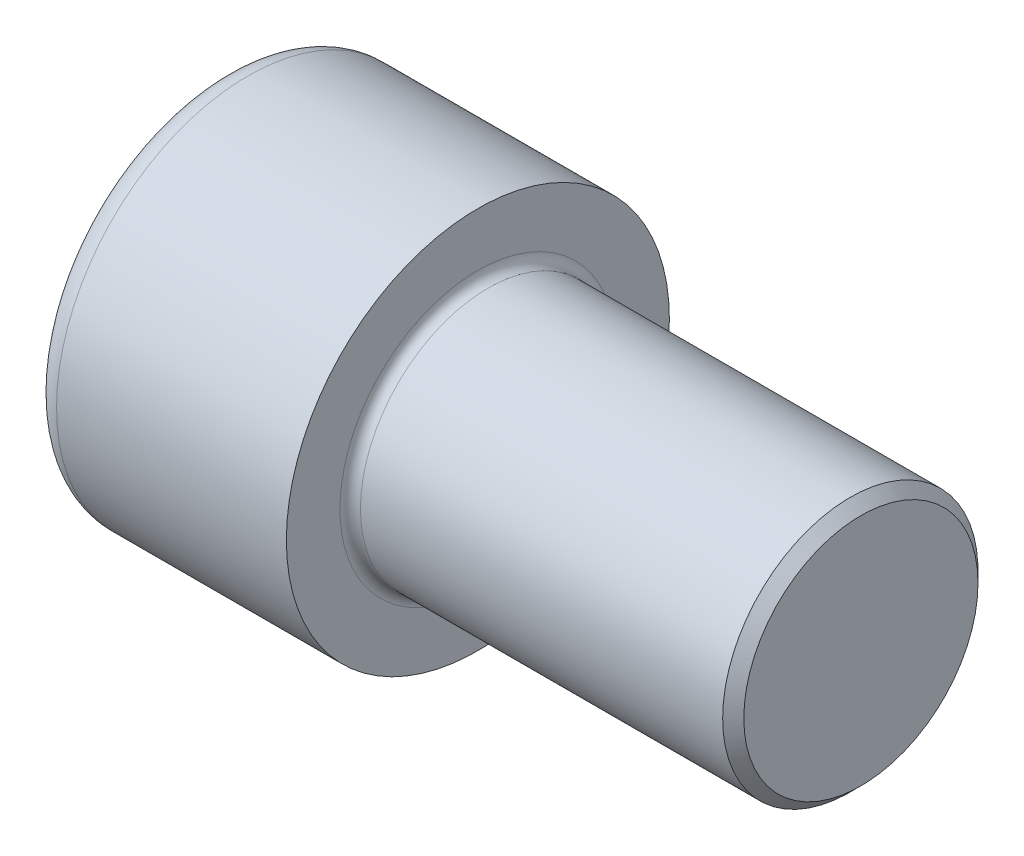
from build123d import *

# Parameters (mm, degrees)
FILLET1_R   = 0.8
FILLET2_R   = 2
HEX_2_DEPTH = 10


with BuildPart() as part:
    # BodySke → Base-Revolve (revolve)
    with BuildSketch(Plane.XY):
        Polygon((0, 0), (0, 15), (20, 15), (20, 10), (49.172, 10), (50, 9.172), (50, 0), align=None)
    revolve(axis=Axis((-31.75, 0, 0), (1, 0, 0)))

    # Fillet1
    fillet1_edges = [part.edges().sort_by_distance(p)[0] for p in [
        (20, -10, 0),
    ]]
    fillet(fillet1_edges, radius=FILLET1_R)

    # Fillet2
    fillet2_edges = [part.edges().sort_by_distance(p)[0] for p in [
        (0, -15, 0),
    ]]
    fillet(fillet2_edges, radius=FILLET2_R)

    # Sketch2 → Hex-PreBroach (revolve, cut)
    with BuildSketch(Plane.XY):
        Polygon((0, 8.525), (10, 8.525), (14.921911045, 0), (0, 0), align=None)
    revolve(axis=Axis((0, 0, 0), (1, 0, 0)), mode=Mode.SUBTRACT)

    # Sketch3 → Hex 2 (cut)
    with BuildSketch(Plane(origin=(0, 0, 0), x_dir=(0, 0.500000000000001, 0.866025403784438), z_dir=(-1, 0, 0))):
        Polygon((4.921911045, 8.525), (-4.921911045, 8.525), (-9.84382209, 0), (-4.921911045, -8.525), (4.921911045, -8.525), (9.84382209, 0), align=None)
    extrude(amount=-HEX_2_DEPTH, mode=Mode.SUBTRACT)


solid = part.part
